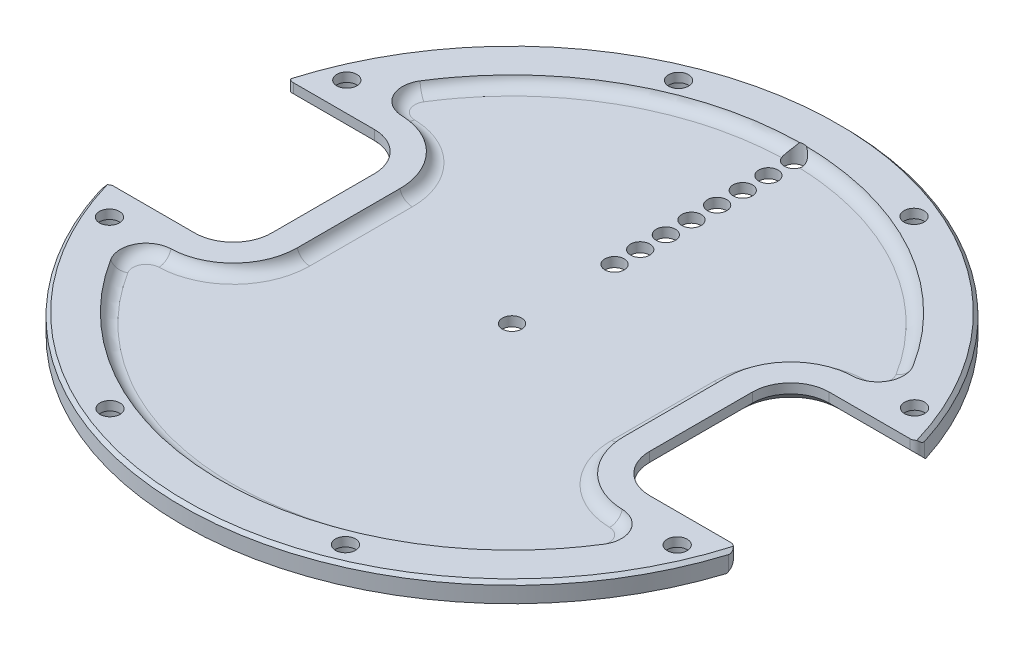
from build123d import *

# Parameters (mm, degrees)
SKETCH1_R               = 81.6102
BOSS_EXTRUDE1_DEPTH     = 4.7625
CUT_EXTRUDE1_DEPTH      = 116.512470731
CUT_EXTRUDE1_DEPTH_BACK = 116.512470731
CUT_EXTRUDE2_DEPTH      = 114.354224753
CUT_EXTRUDE2_DEPTH_BACK = 2.3749
CHAMFER1_SIZE           = 2.3876
FILLET2_R               = 3.175
CUT_EXTRUDE5_DEPTH      = 114.279298624
CUT_EXTRUDE5_DEPTH_BACK = 114.279298624
SKETCH8_R               = 2.3876
CHAMFER3_SIZE           = 0.8128
FILLET4_R               = 1.6002
CUT_EXTRUDE6_START      = -2.50952
SKETCH10_R              = 4.0259
CUT_EXTRUDE6_DEPTH      = 116.486838467
SKETCH11_R              = 2.4765
CUT_EXTRUDE7_DEPTH      = 113.904786311
MIRROR2_START           = -2.50952
MIRROR2_COPY_1_SKETCH_R = 4.0259
MIRROR2_COPY_1_DEPTH    = 116.486838467
MIRROR2_COPY_2_SKETCH_R = 2.4765
MIRROR2_COPY_2_DEPTH    = 113.904786311


with BuildPart() as part:
    # Sketch1 → Boss-Extrude1 (new body)
    with BuildSketch(Plane(origin=(0, 0, 0), x_dir=(1, 0, 0), z_dir=(0, 1, 0))):
        with Locations(Location((0, 0, 0), (0, 0, 90))):
            Circle(SKETCH1_R)
    extrude(amount=BOSS_EXTRUDE1_DEPTH)

    # Sketch2 → Cut-Extrude1 (cut, two sides: drawn at the far end of the back side and taken through both)
    with BuildSketch(Plane(origin=(0, 0, 0), x_dir=(1, 0, 0), z_dir=(0, 1, 0)).offset(-CUT_EXTRUDE1_DEPTH_BACK)):
        with BuildLine():
            Line((-81.6102, 22.225), (-56.3372, 22.225))
            ThreePointArc((-56.3372, 22.225), (-49.602007909, 19.435192091), (-46.8122, 12.7))
            Line((-46.8122, 12.7), (-46.8122, -12.7))
            ThreePointArc((-46.8122, -12.7), (-49.602007909, -19.435192091), (-56.3372, -22.225))
            Line((-56.3372, -22.225), (-81.6102, -22.225))
            Line((-81.6102, -22.225), (-81.6102, 22.225))
        make_face()
        with BuildLine():
            Line((81.6102, 22.225), (56.3372, 22.225))
            ThreePointArc((56.3372, 22.225), (49.602007909, 19.435192091), (46.8122, 12.7))
            Line((46.8122, 12.7), (46.8122, -12.7))
            ThreePointArc((46.8122, -12.7), (49.602007909, -19.435192091), (56.3372, -22.225))
            Line((56.3372, -22.225), (81.6102, -22.225))
            Line((81.6102, -22.225), (81.6102, 22.225))
        make_face()
    extrude(amount=CUT_EXTRUDE1_DEPTH + CUT_EXTRUDE1_DEPTH_BACK, mode=Mode.SUBTRACT)

    # Sketch3 → Cut-Extrude2 (cut, two sides: drawn at the far end of the back side and taken through both)
    with BuildSketch(Plane(origin=(0, 4.7625, 0), x_dir=(1, 0, 0), z_dir=(0, 1, 0)).offset(-CUT_EXTRUDE2_DEPTH_BACK)):
        with BuildLine():
            Line((-40.4622, 12.7), (-40.4622, -12.7))
            ThreePointArc((-40.4622, -12.7), (-44.951021657, -23.762123112), (-55.878964441, -28.568385084))
            ThreePointArc((-55.878964441, -28.568385084), (-61.295550899, -31.921772459), (-61.075854743, -38.288588723))
            ThreePointArc((-61.075854743, -38.288588723), (0, -72.0852), (61.075854743, -38.288588723))
            ThreePointArc((61.075854743, -38.288588723), (61.295550899, -31.921772459), (55.878964441, -28.568385084))
            ThreePointArc((55.878964441, -28.568385084), (44.951021657, -23.762123112), (40.4622, -12.7))
            Line((40.4622, -12.7), (40.4622, 12.7))
            ThreePointArc((40.4622, 12.7), (44.951021657, 23.762123112), (55.878964441, 28.568385084))
            ThreePointArc((55.878964441, 28.568385084), (61.295550899, 31.921772459), (61.075854743, 38.288588723))
            ThreePointArc((61.075854743, 38.288588723), (0, 72.0852), (-61.075854743, 38.288588723))
            ThreePointArc((-61.075854743, 38.288588723), (-61.295550899, 31.921772459), (-55.878964441, 28.568385084))
            ThreePointArc((-55.878964441, 28.568385084), (-44.951021657, 23.762123112), (-40.4622, 12.7))
        make_face()
    extrude(amount=CUT_EXTRUDE2_DEPTH + CUT_EXTRUDE2_DEPTH_BACK, mode=Mode.SUBTRACT)

    # Chamfer1
    chamfer1_edges = [part.edges().sort_by_distance(p)[0] for p in [
        (67.431413574, 0, -22.225),
        (-67.431413574, 0, 22.225),
        (-67.431413574, 0, -22.225),
        (-49.602007909, 0, 19.435192091),
        (-46.8122, 0, 0),
        (-49.602007909, 0, -19.435192091),
        (67.431413574, 0, 22.225),
        (49.602007909, 0, -19.435192091),
        (46.8122, 0, 0),
        (49.602007909, 0, 19.435192091),
    ]]
    chamfer(chamfer1_edges, length=CHAMFER1_SIZE)

    # Fillet2
    # the kernel refuses this fillet: 3.175 mm, written as the material it adds along each edge
    with BuildSketch(Plane(origin=(-56.3372, 2.3876, 12.7), x_dir=(1, 0, 0), z_dir=(0, 0, -1))) as fillet2_piece_1:
        with BuildLine():
            CenterArc((18.947533969, -3.175), FILLET2_R, 90, 75.4041065)
            Line((18.947533969, 0), (18.947533969, 0.0635))
            Line((18.947533969, 0.0635), (15.875, 0.0635))
            Line((15.875, 0.0635), (15.8115, 0))
            ThreePointArc((15.8115, 0), (15.8115, -1.18745), (15.813549321, -2.358898))
            Line((15.813549321, -2.358898), (15.875, -2.3749))
        make_face()
    revolve(axis=Axis((-56.3372, 2.3876, 12.7), (0, -1, 0)), revolution_arc=88.345914275)
    with BuildSketch(Plane(origin=(-40.4622, 2.3876, -12.7), x_dir=(0, 1, 0), z_dir=(0, 0, 1)), Plane(origin=(40.4622, 2.3876, 12.7), x_dir=(0, 1, 0), z_dir=(0, 0, -1))) as fillet2_piece_2:
        with BuildLine():
            CenterArc((3.175, -3.072533969), FILLET2_R, 104.5958935, 75.4041065)
            Line((0, -3.072533969), (-0.0635, -3.072533969))
            Line((-0.0635, -3.072533969), (-0.0635, 0))
            Line((-0.0635, 0), (0, 0.0635))
            ThreePointArc((0, 0.0635), (1.18745, 0.0635), (2.358898, 0.061450679))
            Line((2.358898, 0.061450679), (2.3749, 0))
        make_face()
    extrude(amount=25.4)
    with BuildSketch(Plane(origin=(-56.3372, 2.3876, -12.7), x_dir=(0.028865232082277387, 0, -0.9995833123741293), z_dir=(-0.9995833123741293, 0, -0.028865232082277387))) as fillet2_piece_3:
        with BuildLine():
            CenterArc((18.947533969, -3.175), FILLET2_R, 90, 75.4041065)
            Line((18.947533969, 0), (18.947533969, 0.0635))
            Line((18.947533969, 0.0635), (15.875, 0.0635))
            Line((15.875, 0.0635), (15.8115, 0))
            ThreePointArc((15.8115, 0), (15.8115, -1.18745), (15.813549321, -2.358898))
            Line((15.813549321, -2.358898), (15.875, -2.3749))
        make_face()
    revolve(axis=Axis((-56.3372, 2.3876, -12.7), (0, -1, 0)), revolution_arc=88.345914275)
    with BuildSketch(Plane(origin=(-55.695670217, 2.3876, -34.915739118), x_dir=(-0.8472731537588882, 0, -0.5311574182099571), z_dir=(0.5311574182099571, 0, -0.8472731537588882))) as fillet2_piece_4:
        with BuildLine():
            CenterArc((3.277466031, 3.175), FILLET2_R, 270, 75.4041065)
            Line((3.277466031, 0), (3.277466031, -0.0635))
            Line((3.277466031, -0.0635), (6.35, -0.0635))
            Line((6.35, -0.0635), (6.4135, 0))
            ThreePointArc((6.4135, 0), (6.4135, 1.18745), (6.411450679, 2.358898))
            Line((6.411450679, 2.358898), (6.35, 2.3749))
        make_face()
    revolve(axis=Axis((-55.695670217, 2.3876, -34.915739118), (0, 1, 0)), revolution_arc=120.42960459)
    with BuildSketch(Plane(origin=(0, 2.3876, 0), x_dir=(0.8472731537588896, 0, -0.5311574182099551), z_dir=(0.5311574182099551, 0, 0.8472731537588896))) as fillet2_piece_5:
        with BuildLine():
            CenterArc((69.012666031, 3.175), FILLET2_R, 270, 75.4041065)
            Line((69.012666031, 0), (69.012666031, -0.0635))
            Line((69.012666031, -0.0635), (72.0852, -0.0635))
            Line((72.0852, -0.0635), (72.1487, 0))
            ThreePointArc((72.1487, 0), (72.1487, 1.18745), (72.146650679, 2.358898))
            Line((72.146650679, 2.358898), (72.0852, 2.3749))
        make_face()
    revolve(axis=Axis((0, 2.3876, 0), (0, 1, 0)), revolution_arc=115.83261937)
    with BuildSketch(Plane(origin=(55.695670217, 2.3876, -34.915739118), x_dir=(0.028865232082276503, 0, 0.9995833123741293), z_dir=(-0.9995833123741293, 0, 0.028865232082276503))) as fillet2_piece_6:
        with BuildLine():
            CenterArc((3.277466031, 3.175), FILLET2_R, 270, 75.4041065)
            Line((3.277466031, 0), (3.277466031, -0.0635))
            Line((3.277466031, -0.0635), (6.35, -0.0635))
            Line((6.35, -0.0635), (6.4135, 0))
            ThreePointArc((6.4135, 0), (6.4135, 1.18745), (6.411450679, 2.358898))
            Line((6.411450679, 2.358898), (6.35, 2.3749))
        make_face()
    revolve(axis=Axis((55.695670217, 2.3876, -34.915739118), (0, 1, 0)), revolution_arc=120.42960459)
    with BuildSketch(Plane(origin=(56.3372, 2.3876, -12.7), x_dir=(-1, 0, 0), z_dir=(0, 0, 1))) as fillet2_piece_7:
        with BuildLine():
            CenterArc((18.947533969, -3.175), FILLET2_R, 90, 75.4041065)
            Line((18.947533969, 0), (18.947533969, 0.0635))
            Line((18.947533969, 0.0635), (15.875, 0.0635))
            Line((15.875, 0.0635), (15.8115, 0))
            ThreePointArc((15.8115, 0), (15.8115, -1.18745), (15.813549321, -2.358898))
            Line((15.813549321, -2.358898), (15.875, -2.3749))
        make_face()
    revolve(axis=Axis((56.3372, 2.3876, -12.7), (0, -1, 0)), revolution_arc=88.345914275)
    with BuildSketch(Plane(origin=(56.3372, 2.3876, 12.7), x_dir=(-0.028865232082277835, 0, 0.9995833123741293), z_dir=(0.9995833123741293, 0, 0.028865232082277835))) as fillet2_piece_8:
        with BuildLine():
            CenterArc((18.947533969, -3.175), FILLET2_R, 90, 75.4041065)
            Line((18.947533969, 0), (18.947533969, 0.0635))
            Line((18.947533969, 0.0635), (15.875, 0.0635))
            Line((15.875, 0.0635), (15.8115, 0))
            ThreePointArc((15.8115, 0), (15.8115, -1.18745), (15.813549321, -2.358898))
            Line((15.813549321, -2.358898), (15.875, -2.3749))
        make_face()
    revolve(axis=Axis((56.3372, 2.3876, 12.7), (0, -1, 0)), revolution_arc=88.345914275)
    with BuildSketch(Plane(origin=(55.695670217, 2.3876, 34.915739118), x_dir=(0.84727315375889, 0, 0.5311574182099543), z_dir=(-0.5311574182099543, 0, 0.84727315375889))) as fillet2_piece_9:
        with BuildLine():
            CenterArc((3.277466031, 3.175), FILLET2_R, 270, 75.4041065)
            Line((3.277466031, 0), (3.277466031, -0.0635))
            Line((3.277466031, -0.0635), (6.35, -0.0635))
            Line((6.35, -0.0635), (6.4135, 0))
            ThreePointArc((6.4135, 0), (6.4135, 1.18745), (6.411450679, 2.358898))
            Line((6.411450679, 2.358898), (6.35, 2.3749))
        make_face()
    revolve(axis=Axis((55.695670217, 2.3876, 34.915739118), (0, 1, 0)), revolution_arc=120.42960459)
    with BuildSketch(Plane(origin=(0, 2.3876, 0), x_dir=(-0.8472731537588895, 0, 0.5311574182099552), z_dir=(-0.5311574182099552, 0, -0.8472731537588895))) as fillet2_piece_10:
        with BuildLine():
            CenterArc((69.012666031, 3.175), FILLET2_R, 270, 75.4041065)
            Line((69.012666031, 0), (69.012666031, -0.0635))
            Line((69.012666031, -0.0635), (72.0852, -0.0635))
            Line((72.0852, -0.0635), (72.1487, 0))
            ThreePointArc((72.1487, 0), (72.1487, 1.18745), (72.146650679, 2.358898))
            Line((72.146650679, 2.358898), (72.0852, 2.3749))
        make_face()
    revolve(axis=Axis((0, 2.3876, 0), (0, 1, 0)), revolution_arc=115.83261937)
    with BuildSketch(Plane(origin=(-55.695670217, 2.3876, 34.915739118), x_dir=(-0.028865232082276503, 0, -0.9995833123741293), z_dir=(0.9995833123741293, 0, -0.028865232082276503))) as fillet2_piece_11:
        with BuildLine():
            CenterArc((3.277466031, 3.175), FILLET2_R, 270, 75.4041065)
            Line((3.277466031, 0), (3.277466031, -0.0635))
            Line((3.277466031, -0.0635), (6.35, -0.0635))
            Line((6.35, -0.0635), (6.4135, 0))
            ThreePointArc((6.4135, 0), (6.4135, 1.18745), (6.411450679, 2.358898))
            Line((6.411450679, 2.358898), (6.35, 2.3749))
        make_face()
    revolve(axis=Axis((-55.695670217, 2.3876, 34.915739118), (0, 1, 0)), revolution_arc=120.42960459)

    # Sketch8 → Cut-Extrude5 (cut, two sides: drawn at the far end of the back side and taken through both)
    with BuildSketch(Plane(origin=(0, 2.3876, 0), x_dir=(1, 0, 0), z_dir=(0, 1, 0)).offset(-CUT_EXTRUDE5_DEPTH_BACK)):
        with Locations(Location((0, 69.85, 0), (0, 0, 270))):
            Circle(SKETCH8_R)
        with Locations(Location((0, 63.5, 0), (0, 0, 270))):
            Circle(SKETCH8_R)
        with Locations(Location((0, 57.15, 0), (0, 0, 270))):
            Circle(SKETCH8_R)
        with Locations(Location((0, 50.8, 0), (0, 0, 270))):
            Circle(SKETCH8_R)
        with Locations(Location((0, 44.45, 0), (0, 0, 270))):
            Circle(SKETCH8_R)
        with Locations(Location((0, 38.1, 0), (0, 0, 270))):
            Circle(SKETCH8_R)
        with Locations(Location((0, 31.75, 0), (0, 0, 270))):
            Circle(SKETCH8_R)
        with Locations(Location((0, 25.4, 0), (0, 0, 270))):
            Circle(SKETCH8_R)
        with Locations(Location((0, 0, 0), (0, 0, 270))):
            Circle(SKETCH8_R)
    extrude(amount=CUT_EXTRUDE5_DEPTH + CUT_EXTRUDE5_DEPTH_BACK, mode=Mode.SUBTRACT)

    # Chamfer3
    chamfer3_edges = [part.edges().sort_by_distance(p)[0] for p in [
        (0, 4.7625, -81.6102),
        (0, 4.7625, 81.6102),
    ]]
    chamfer(chamfer3_edges, length=CHAMFER3_SIZE)

    # Fillet4
    fillet4_edges = [part.edges().sort_by_distance(p)[0] for p in [
        (78.525627148, 3.16865, -22.225),
        (78.525627148, 3.16865, 22.225),
        (-78.525627148, 3.16865, 22.225),
        (-78.525627148, 3.16865, -22.225),
    ]]
    fillet(fillet4_edges, radius=FILLET4_R)

    # Sketch10 → Cut-Extrude6 (cut)
    with BuildSketch(Plane.XZ.offset(CUT_EXTRUDE6_START)):
        with Locations(Location((-70.302533668, 29.393770766, 0), (0, 0, 270))):
            Circle(SKETCH10_R)
        with Locations(Location((-29.160477546, 70.399620377, 0), (0, 0, 270))):
            Circle(SKETCH10_R)
    cut_extrude6 = extrude(amount=CUT_EXTRUDE6_DEPTH, mode=Mode.SUBTRACT)

    # Sketch11 → Cut-Extrude7 (cut, symmetric)
    with BuildSketch(Plane.XZ.offset(-2.50952)):
        with Locations(Location((-70.302533668, 29.393770766, 0), (0, 0, 270))):
            Circle(SKETCH11_R)
        with Locations(Location((-29.160477546, 70.399620377, 0), (0, 0, 270))):
            Circle(SKETCH11_R)
    cut_extrude7 = extrude(amount=CUT_EXTRUDE7_DEPTH, both=True, mode=Mode.SUBTRACT)

    # Mirror1: Cut-Extrude6, Cut-Extrude7 across plane
    add(cut_extrude6.mirror(Plane(origin=(0, 0, 0), x_dir=(0, 0, 1), z_dir=(1, 0, 0))), mode=Mode.SUBTRACT)
    add(cut_extrude7.mirror(Plane(origin=(0, 0, 0), x_dir=(0, 0, 1), z_dir=(1, 0, 0))), mode=Mode.SUBTRACT)

    # Mirror2: Cut-Extrude6, Cut-Extrude7 across plane
    add(cut_extrude6.mirror(Plane.XY), mode=Mode.SUBTRACT)
    add(cut_extrude7.mirror(Plane.XY), mode=Mode.SUBTRACT)

    # Mirror2 copy 1 sketch → Mirror2 copy 1 (cut)
    with BuildSketch(Plane(origin=(0, 0, 0), x_dir=(-1, 0, 0), z_dir=(0, -1, 0)).offset(MIRROR2_START)):
        with Locations(Location((-70.302533668, 29.393770766, 0), (0, 0, 270))):
            Circle(MIRROR2_COPY_1_SKETCH_R)
        with Locations(Location((-29.160477546, 70.399620377, 0), (0, 0, 270))):
            Circle(MIRROR2_COPY_1_SKETCH_R)
    extrude(amount=MIRROR2_COPY_1_DEPTH, mode=Mode.SUBTRACT)

    # Mirror2 copy 2 sketch → Mirror2 copy 2 (cut, symmetric)
    with BuildSketch(Plane(origin=(0, 2.50952, 0), x_dir=(-1, 0, 0), z_dir=(0, -1, 0))):
        with Locations(Location((-70.302533668, 29.393770766, 0), (0, 0, 270))):
            Circle(MIRROR2_COPY_2_SKETCH_R)
        with Locations(Location((-29.160477546, 70.399620377, 0), (0, 0, 270))):
            Circle(MIRROR2_COPY_2_SKETCH_R)
    extrude(amount=MIRROR2_COPY_2_DEPTH, both=True, mode=Mode.SUBTRACT)


solid = part.part
